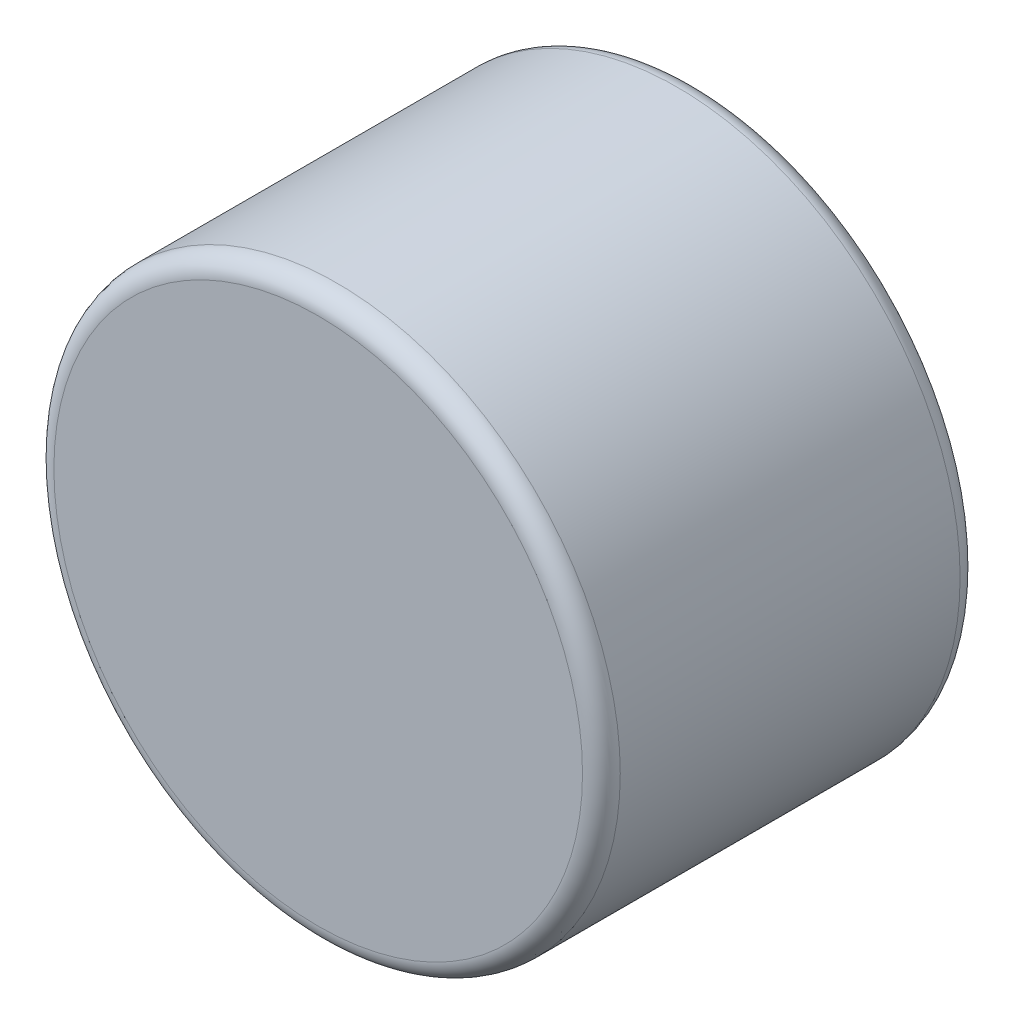
from build123d import *

# Parameters (mm, degrees)
SKETCH_1_R      = 1.5
EXTRUDE_1_DEPTH = 2
FILLET_1_R      = 0.1


with BuildPart() as part:
    # Эскиз1 → Бобышка-Вытянуть1 (new body)
    with BuildSketch(Plane.XY):
        Circle(SKETCH_1_R)
    extrude(amount=EXTRUDE_1_DEPTH)

    # Скругление1
    fillet_1_edges = [part.edges().sort_by_distance(p)[0] for p in [
        (-1.5, 0, 0),
        (-1.5, 0, 2),
    ]]
    fillet(fillet_1_edges, radius=FILLET_1_R)


solid = part.part
